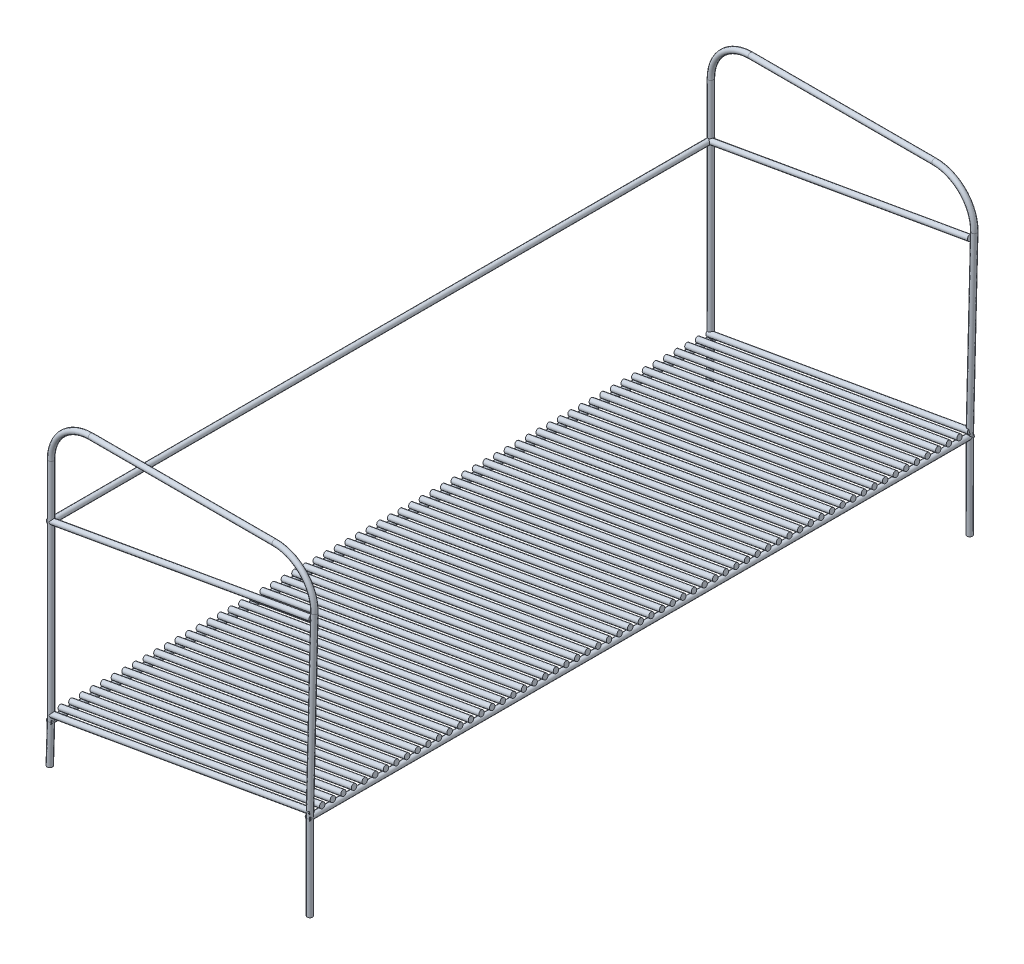
from build123d import *

# Parameters (mm, degrees)
ESQUISSE1_R                      = 2
BOSS_EXTRU_1_DEPTH               = 500
ESQUISSE4_R                      = 2
BOSS_EXTRU_3_DEPTH               = 200
R_P_TITION_LIN_AIRE2_COUNT       = 62
R_P_TITION_LIN_AIRE2_PITCH       = 8
ESQUISSE5_R                      = 2
BOSS_EXTRU_4_DEPTH               = 500
ESQUISSE30_R                     = 2
R_P_TITION_LIN_AIRE3_COUNT       = 2
R_P_TITION_LIN_AIRE3_PITCH       = 497
R_P_TITION_LIN_AIRE4_COUNT       = 2
R_P_TITION_LIN_AIRE4_PITCH       = 130
R_P_TITION_LIN_AIRE10_COUNT      = 2
R_P_TITION_LIN_AIRE10_PITCH      = 496
R_P_TITION_LIN_AIRE10_COUNT_DIR2 = 2
R_P_TITION_LIN_AIRE10_PITCH_DIR2 = 126


with BuildPart() as part:
    # Esquisse1 → Boss.-Extru.1 (new body)
    with BuildSketch(Plane.XY):
        Circle(ESQUISSE1_R)
    boss_extru_1 = extrude(amount=BOSS_EXTRU_1_DEPTH)



with BuildPart() as body_2:
    # Esquisse4 → Boss.-Extru.3 (new body)
    with BuildSketch(Plane(origin=(0, 0, 100.428002704), x_dir=(0, 0, -1), z_dir=(0.9848077530122086, 0.17364817766692736, 0))):
        with Locations((-398.055965611, 4.001374663)):
            Circle(ESQUISSE4_R)
    boss_extru_3 = extrude(amount=BOSS_EXTRU_3_DEPTH)


with BuildPart() as r_p_tition_lin_aire2_1:
    # Répétition linéaire2: Boss.-Extru.3 ×62
    with Locations(*[(0, 0, -i * R_P_TITION_LIN_AIRE2_PITCH) for i in range(1, R_P_TITION_LIN_AIRE2_COUNT)]):
        add(boss_extru_3)


with BuildPart() as body_64:
    # Esquisse5 → Boss.-Extru.4 (new body)
    with BuildSketch(Plane(origin=(-0.100298871, -3.768925192, 0), x_dir=(1, 0, 0), z_dir=(0, 0, 1))):
        with Locations((195.061701915, 38.147276614)):
            Circle(ESQUISSE5_R)
    extrude(amount=BOSS_EXTRU_4_DEPTH)


with BuildPart() as part_1:
    add(part.part)

    add(body_64.part)  # Balayage8 merges body 64
    # Balayage8: sweep along a path in Esquisse29
    with BuildLine(Plane.XY) as balayage8_path:
        Line((-0.98020628, -30), (0, 0))
        Line((0, 0), (0, 170.203288726))
        ThreePointArc((0, 170.203288726), (8.786796564, 191.416492162), (30, 200.203288726))
        Line((30, 200.203288726), (168.368433889, 200.203288726))
        ThreePointArc((168.368433889, 200.203288726), (189.846693903, 191.148081558), (198.358947648, 169.448911844))
        Line((198.358947648, 169.448911844), (194.961403044, 34.378351422))
        Line((194.961403044, 34.378351422), (194.961403044, -30))
    # Esquisse30 → Balayage8 (sweep)
    with BuildSketch(Plane(origin=(0, -30, 0), x_dir=(1, 0, 0), z_dir=(0, 1, 0))):
        with Locations((194.961403044, -1.492249163)):
            Circle(ESQUISSE30_R)
    balayage8 = sweep(path=balayage8_path.line, transition=Transition.RIGHT)


    add(body_2.part)  # Répétition linéaire3 merges body 2
    # Répétition linéaire3: Balayage8 ×2
    with Locations(*[(0, 0, i * R_P_TITION_LIN_AIRE3_PITCH) for i in range(1, R_P_TITION_LIN_AIRE3_COUNT)]):
        add(balayage8)

    # Répétition linéaire4: Boss.-Extru.1 ×2
    with Locations(*[(0, i * R_P_TITION_LIN_AIRE4_PITCH, 0) for i in range(1, R_P_TITION_LIN_AIRE4_COUNT)]):
        add(boss_extru_1)


with BuildPart() as r_p_tition_lin_aire10_1:
    # Répétition linéaire10: Boss.-Extru.3 2 × 2
    with Locations(*[(0, j * R_P_TITION_LIN_AIRE10_PITCH_DIR2, -i * R_P_TITION_LIN_AIRE10_PITCH) for i in range(R_P_TITION_LIN_AIRE10_COUNT) for j in range(R_P_TITION_LIN_AIRE10_COUNT_DIR2) if (i, j) != (0, 0)]):
        add(boss_extru_3)


solid = Compound([r_p_tition_lin_aire2_1.part, part_1.part, r_p_tition_lin_aire10_1.part])
